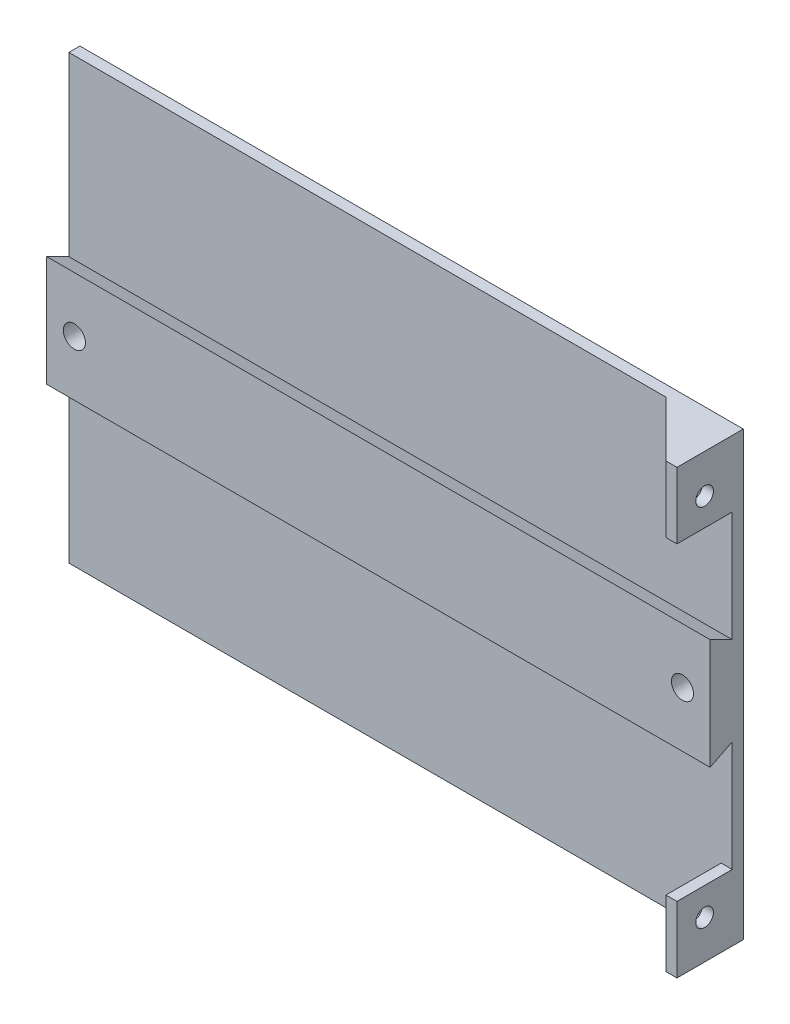
from build123d import *

# Parameters (mm, degrees)
SKETCH1_W             = 15
SKETCH1_H             = 60
BOSS_EXTRUDE1_DEPTH   = 1
BOSS_EXTRUDE1_2_DEPTH = 1
SKETCH1_3_W           = 10
SKETCH1_3_H           = 60
BOSS_EXTRUDE2_DEPTH   = 3
CUT_EXTRUDE1_DEPTH    = 66
SKETCH5_R             = 1
CUT_EXTRUDE2_DEPTH    = 10
SKETCH7_W             = 6
SKETCH7_H             = 6
BOSS_EXTRUDE7_DEPTH   = 1
BOSS_EXTRUDE8_DEPTH   = 1
BOSS_EXTRUDE9_DEPTH   = 1
M2_TAPPED_HOLE1_D     = 1.6
M2_TAPPED_HOLE1_DEPTH = 6
M2_TAPPED_HOLE1_TIP   = 0.480688495


with BuildPart() as part:
    # Sketch1 → Boss-Extrude1 (new body)
    with BuildSketch(Plane(origin=(0, 0, 0), x_dir=(0, 1, 0), z_dir=(0, 0, 1))):
        with Locations((-12.5, 0)):
            Rectangle(SKETCH1_W, SKETCH1_H)
    extrude(amount=BOSS_EXTRUDE1_DEPTH)



with BuildPart() as body_2:
    # Sketch1 → Boss-Extrude1 2 (new body)
    with BuildSketch(Plane(origin=(0, 0, 0), x_dir=(0, 1, 0), z_dir=(0, 0, 1))):
        with Locations((12.5, 0)):
            Rectangle(SKETCH1_W, SKETCH1_H)
    extrude(amount=BOSS_EXTRUDE1_2_DEPTH)


with BuildPart() as part_1:
    add(part.part)

    add(body_2.part)  # Boss-Extrude2 merges body 2
    # Sketch1<3> → Boss-Extrude2 (add)
    with BuildSketch(Plane(origin=(0, 0, 0), x_dir=(0, 1, 0), z_dir=(0, 0, 1))):
        Rectangle(SKETCH1_3_W, SKETCH1_3_H)
    extrude(amount=BOSS_EXTRUDE2_DEPTH)

    # Sketch2 → Cut-Extrude1 (cut)
    with BuildSketch(Plane.YZ.offset(30)):
        Polygon((-5, 1), (-4, 1), (-5, 3), align=None)
        Polygon((5, 1), (4, 1), (5, 3), align=None)
    extrude(amount=-CUT_EXTRUDE1_DEPTH, mode=Mode.SUBTRACT)

    # Sketch5 → Cut-Extrude2 (cut)
    with BuildSketch(Plane.XY.offset(3)):
        with Locations((-27.5, 0)):
            Circle(SKETCH5_R)
        with Locations((27.5, 0)):
            Circle(SKETCH5_R)
    extrude(amount=-CUT_EXTRUDE2_DEPTH, mode=Mode.SUBTRACT)

    # Sketch7 → Boss-Extrude7 (add)
    with BuildSketch(Plane.YZ.offset(30)):
        with Locations((-17, 3)):
            Rectangle(SKETCH7_W, SKETCH7_H)
        with Locations((17, 3)):
            Rectangle(SKETCH7_W, SKETCH7_H)
    extrude(amount=-BOSS_EXTRUDE7_DEPTH)

    # Sketch10 → Boss-Extrude8 (add)
    with BuildSketch(Plane.XZ.offset(20)):
        Polygon((29, 6), (24, 1), (29, 1), align=None)
    extrude(amount=-BOSS_EXTRUDE8_DEPTH)

    # Sketch11 → Boss-Extrude9 (add)
    with BuildSketch(Plane(origin=(0, 20, 0), x_dir=(-1, 0, 0), z_dir=(0, 1, 0))):
        Polygon((-29, 6), (-24, 1), (-29, 1), align=None)
    extrude(amount=-BOSS_EXTRUDE9_DEPTH)

    # M2 Tapped Hole1
    with Locations(Plane(origin=(29, 0, 0), x_dir=(0, -1, 0), z_dir=(-1, 0, 0))):
        with Locations((-16.5, 3.5), (16.5, 3.5)):
            Hole(M2_TAPPED_HOLE1_D / 2, depth=M2_TAPPED_HOLE1_DEPTH)
            with Locations((0, 0, -(M2_TAPPED_HOLE1_DEPTH + M2_TAPPED_HOLE1_TIP / 2))):  # 118° drill point
                Cone(0, M2_TAPPED_HOLE1_D / 2, M2_TAPPED_HOLE1_TIP, mode=Mode.SUBTRACT)


solid = part_1.part
